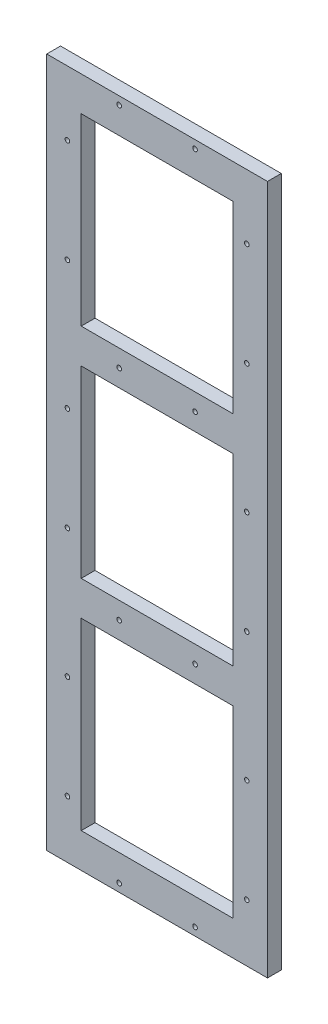
from build123d import *

# Parameters (mm, degrees)
SKETCH1_W           = 96
SKETCH1_H           = 300
SKETCH1_W_2         = 66
SKETCH1_H_2         = 80
BOSS_EXTRUDE1_DEPTH = 6
SKETCH3_R           = 1
CUT_EXTRUDE6_DEPTH  = 10
SKETCH4_R           = 1
CUT_EXTRUDE8_DEPTH  = 10


with BuildPart() as part:
    # Sketch1 → Boss-Extrude1 (new body)
    with BuildSketch(Plane.XY):
        with Locations((0, 6)):
            Rectangle(SKETCH1_W, SKETCH1_H)
        with Locations((0, 101)):
            Rectangle(SKETCH1_W_2, SKETCH1_H_2, mode=Mode.SUBTRACT)
        with Locations((0, -89)):
            Rectangle(SKETCH1_W_2, SKETCH1_H_2, mode=Mode.SUBTRACT)
        with Locations((0, 6)):
            Rectangle(SKETCH1_W_2, SKETCH1_H_2, mode=Mode.SUBTRACT)
    extrude(amount=BOSS_EXTRUDE1_DEPTH)

    # Sketch3 → Cut-Extrude6 (cut)
    with BuildSketch(Plane.XY.offset(6)):
        with Locations((-39, 128)):
            Circle(SKETCH3_R)
        with Locations((-16.5, 152.5)):
            Circle(SKETCH3_R)
        with Locations((16.5, 152.5)):
            Circle(SKETCH3_R)
        with Locations((-16.5, 53.5)):
            Circle(SKETCH3_R)
        with Locations((16.5, 53.5)):
            Circle(SKETCH3_R)
        with Locations((-39, 27)):
            Circle(SKETCH3_R)
        with Locations((39, 128)):
            Circle(SKETCH3_R)
        with Locations((39, 83)):
            Circle(SKETCH3_R)
        with Locations((-39, 83)):
            Circle(SKETCH3_R)
        with Locations((39, 27)):
            Circle(SKETCH3_R)
        with Locations((39, -18)):
            Circle(SKETCH3_R)
        with Locations((-39, -18)):
            Circle(SKETCH3_R)
        with Locations((-39, -74)):
            Circle(SKETCH3_R)
        with Locations((39, -74)):
            Circle(SKETCH3_R)
        with Locations((39, -119)):
            Circle(SKETCH3_R)
        with Locations((-39, -119)):
            Circle(SKETCH3_R)
    extrude(amount=-CUT_EXTRUDE6_DEPTH, mode=Mode.SUBTRACT)

    # Sketch4 → Cut-Extrude8 (cut)
    with BuildSketch(Plane.XY.offset(6)):
        with Locations((16.5, -41.5)):
            Circle(SKETCH4_R)
        with Locations((-16.5, -41.5)):
            Circle(SKETCH4_R)
        with Locations((16.5, 152.5)):
            Circle(SKETCH4_R)
        with Locations((-16.5, 152.5)):
            Circle(SKETCH4_R)
        with Locations((-16.5, 53.5)):
            Circle(SKETCH4_R)
        with Locations((16.5, 53.5)):
            Circle(SKETCH4_R)
        with Locations((-16.5, -140.5)):
            Circle(SKETCH4_R)
        with Locations((16.5, -140.5)):
            Circle(SKETCH4_R)
    extrude(amount=-CUT_EXTRUDE8_DEPTH, mode=Mode.SUBTRACT)


solid = part.part
